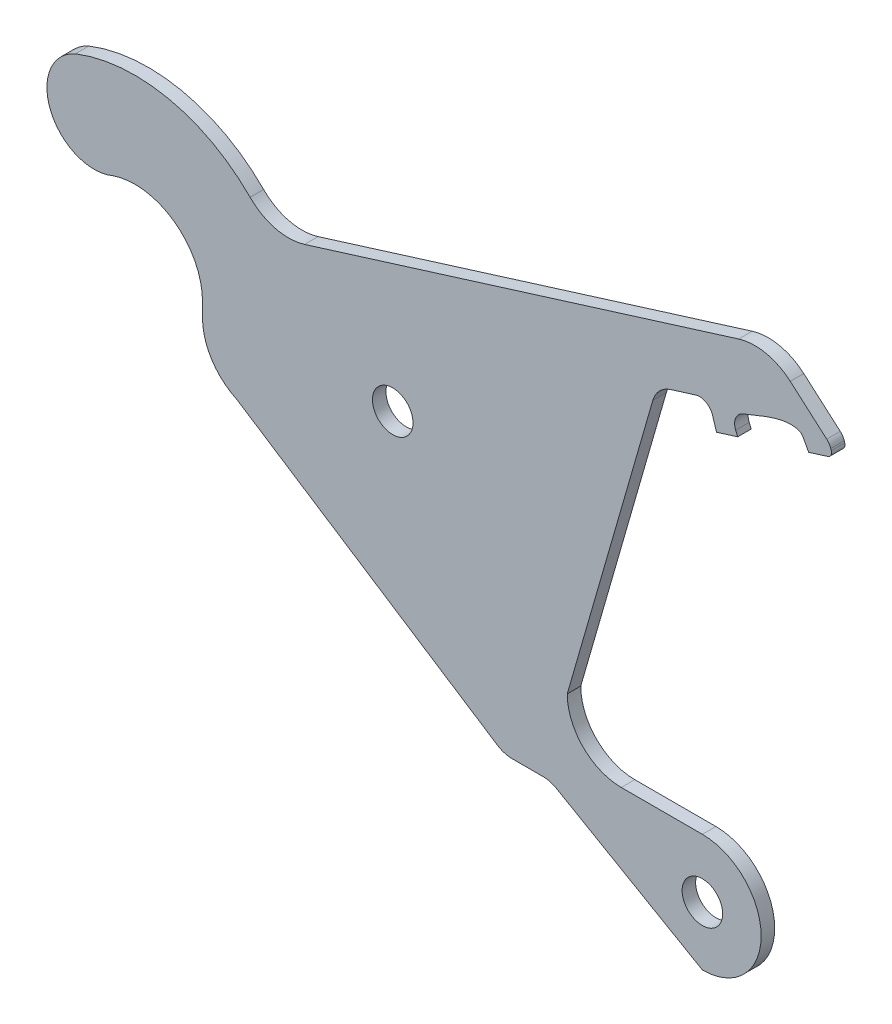
from build123d import *

# Parameters (mm, degrees)
BRIDA_START                = -0.25
BRIDA_BASE1_DEPTH          = 0.25
TALADRO_ROSCADO_M1X0_251_D = 0.75


# Read off the part's stored shape, not the designer's step: Brida base1
with BuildPart() as part:
    # Brida base1 outline → Brida base1 (new body)
    with BuildSketch(Plane.XY.offset(BRIDA_START)):
        with BuildLine():
            ThreePointArc((0.348995339, -0.802388468), (1.480310371, -0.971394868), (2.002599123, -1.989064424))
            Line((2.002599123, -1.989064424), (2.002599123, -2.249894418))
            ThreePointArc((2.002599123, -2.249894418), (2.173526137, -2.836318439), (2.632769916, -3.239064424))
            Line((2.632769916, -3.239064424), (7.459467188, -6.370598579))
            ThreePointArc((7.459467188, -6.370598579), (7.589701514, -6.430586338), (7.731605769, -6.45114585))
            Line((7.731605769, -6.45114585), (8.301442841, -6.45114585))
            ThreePointArc((8.301442841, -6.45114585), (8.430852364, -6.468182936), (8.551442841, -6.518133148))
            Line((8.551442841, -6.518133148), (11.25, -8.07614585))
            ThreePointArc((11.25, -8.07614585), (12.337081426, -6.989064424), (11.25, -5.901982998))
            Line((11.25, -5.901982998), (9.75, -5.901982998))
            ThreePointArc((9.75, -5.901982998), (9.042893219, -5.609089779), (8.75, -4.901982998))
            Line((8.75, -4.901982998), (10.332976724, 0.591177382))
            ThreePointArc((10.332976724, 0.591177382), (10.456141159, 0.802507984), (10.664811028, 0.930128463))
            Line((10.664811028, 0.930128463), (11.123681953, 1.072973914))
            ThreePointArc((11.123681953, 1.072973914), (11.314233531, 1.055602999), (11.436690752, 0.908579595))
            Line((11.436690752, 0.908579595), (11.510997991, 0.669878036))
            Line((11.510997991, 0.669878036), (11.903767414, 0.792146243))
            Line((11.903767414, 0.792146243), (11.866336414, 0.880361426))
            ThreePointArc((11.866336414, 0.880361426), (11.864794565, 1.071948516), (11.999325595, 1.208364763))
            add(Edge.make_bspline(
                [(11.999325595, 1.208364763), (12.49380663, 1.416910388), (12.823037685, 1.541751032), (13.047571984, 1.455257851)],
                knots=[0, 0, 0, 0, 1, 1, 1, 1], degree=3))
            ThreePointArc((13.047571984, 1.455257851), (13.084455869, 1.42899739), (13.111823575, 1.392927439))
            Line((13.111823575, 1.392927439), (13.216225488, 1.200711385))
            Line((13.216225488, 1.200711385), (13.568106318, 1.310251069))
            ThreePointArc((13.568106318, 1.310251069), (13.62691568, 1.359233957), (13.633864046, 1.435454588))
            Line((13.633864046, 1.435454588), (13.624738221, 1.464770016))
            ThreePointArc((13.624738221, 1.464770016), (13.595468937, 1.526984286), (13.550358844, 1.578872492))
            Line((13.550358844, 1.578872492), (12.875597811, 2.16736765))
            ThreePointArc((12.875597811, 2.16736765), (12.424531871, 2.392233856), (11.921080127, 2.368535026))
            Line((11.921080127, 2.368535026), (3.891256423, -0.131130397))
            ThreePointArc((3.891256423, -0.131130397), (3.351888367, -0.146565708), (2.883020599, 0.120490773))
            ThreePointArc((2.883020599, 0.120490773), (1.369312664, 0.946314909), (-0.348995339, 0.802388468))
            ThreePointArc((-0.348995339, 0.802388468), (-0.802388468, -0.348995339), (0.348995339, -0.802388468))
        make_face()
    extrude(amount=BRIDA_BASE1_DEPTH)

    # Taladro roscado M1x0.251 (through all)
    with Locations(Plane.XY):
        with Locations((5.521572875, -1.989064424), (11.25, -6.989064424), (0.75, -1.989064424)):
            Hole(TALADRO_ROSCADO_M1X0_251_D / 2)


solid = part.part
